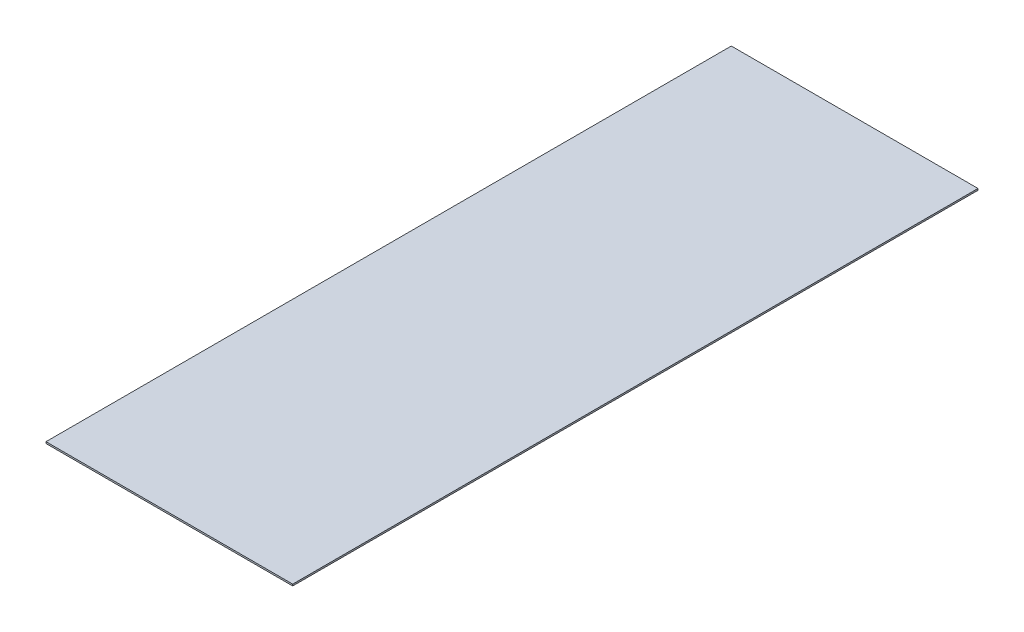
from build123d import *

# Parameters (mm, degrees)
SKETCH1_W          = 114.3
SKETCH1_H          = 317.5
BASE_FLANGE1_DEPTH = 0.762


# Sheet-metal steps are written as plain solids
with BuildPart() as part:
    # Sketch1 → Base-Flange1 (new body)
    with BuildSketch(Plane(origin=(0, 0, 0), x_dir=(1, 0, 0), z_dir=(0, 1, 0))):
        with Locations((57.15, 158.75)):
            Rectangle(SKETCH1_W, SKETCH1_H)
    extrude(amount=-BASE_FLANGE1_DEPTH)


solid = part.part
